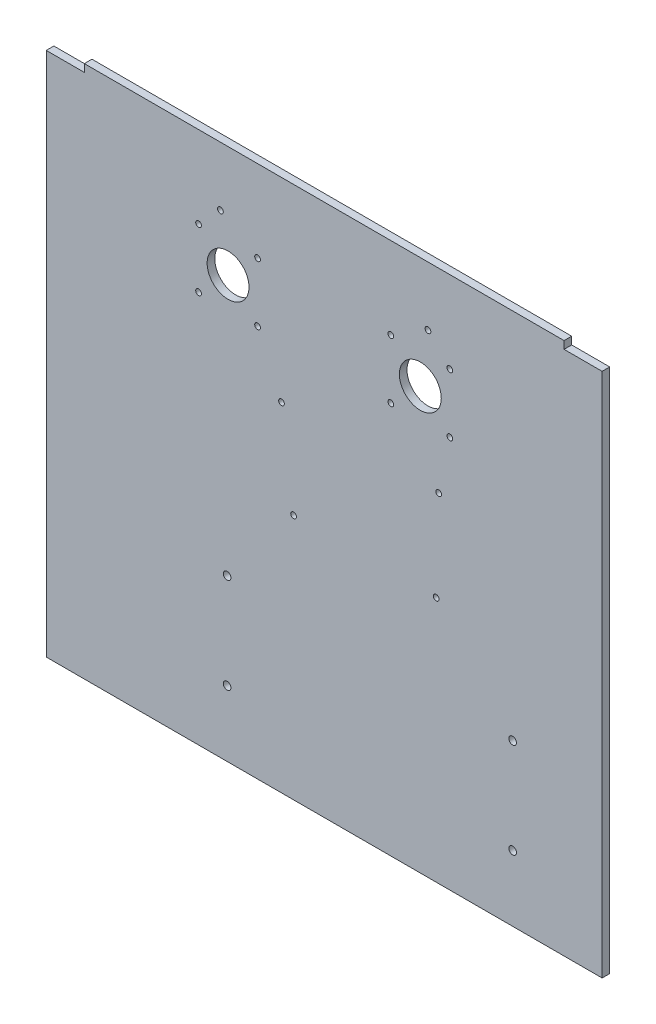
from build123d import *

# Parameters (mm, degrees)
SKETCH1_R           = 2
SKETCH1_R_2         = 1.5
SKETCH1_R_3         = 11
BOSS_EXTRUDE1_DEPTH = 4


with BuildPart() as part:
    # Sketch1 → Boss-Extrude1 (new body)
    with BuildSketch(Plane.XY):
        Polygon((-146, -123.5), (146, -123.5), (146, 152.5), (126, 152.5), (126, 156.5), (-126, 156.5), (-126, 152.5), (-146, 152.5), align=None)
        with Locations((-51, -89)):
            Circle(SKETCH1_R, mode=Mode.SUBTRACT)
        with Locations((-51, -39)):
            Circle(SKETCH1_R, mode=Mode.SUBTRACT)
        with Locations((-16.078681203, 5.935129713)):
            Circle(SKETCH1_R_2, mode=Mode.SUBTRACT)
        with Locations((99, -89)):
            Circle(SKETCH1_R, mode=Mode.SUBTRACT)
        with Locations((58.851318797, 5.935129713)):
            Circle(SKETCH1_R_2, mode=Mode.SUBTRACT)
        with Locations((99, -39)):
            Circle(SKETCH1_R, mode=Mode.SUBTRACT)
        with Locations((-66, 82.5)):
            Circle(SKETCH1_R_2, mode=Mode.SUBTRACT)
        with Locations((-22.428681203, 54.195129713)):
            Circle(SKETCH1_R_2, mode=Mode.SUBTRACT)
        with Locations((-35, 82.5)):
            Circle(SKETCH1_R_2, mode=Mode.SUBTRACT)
        with Locations((-50.5, 98)):
            Circle(SKETCH1_R_3, mode=Mode.SUBTRACT)
        with Locations((-66, 113.5)):
            Circle(SKETCH1_R_2, mode=Mode.SUBTRACT)
        with Locations((-35, 113.5)):
            Circle(SKETCH1_R_2, mode=Mode.SUBTRACT)
        with Locations((35, 82.5)):
            Circle(SKETCH1_R_2, mode=Mode.SUBTRACT)
        with Locations((60.121318797, 54.195129713)):
            Circle(SKETCH1_R_2, mode=Mode.SUBTRACT)
        with Locations((66, 82.5)):
            Circle(SKETCH1_R_2, mode=Mode.SUBTRACT)
        with Locations((35, 113.5)):
            Circle(SKETCH1_R_2, mode=Mode.SUBTRACT)
        with Locations((50.5, 98)):
            Circle(SKETCH1_R_3, mode=Mode.SUBTRACT)
        with Locations((66, 113.5)):
            Circle(SKETCH1_R_2, mode=Mode.SUBTRACT)
        with Locations((54.5, 125.5)):
            Circle(SKETCH1_R_2, mode=Mode.SUBTRACT)
        with Locations((-54.5, 125.5)):
            Circle(SKETCH1_R_2, mode=Mode.SUBTRACT)
    extrude(amount=BOSS_EXTRUDE1_DEPTH)


solid = part.part
